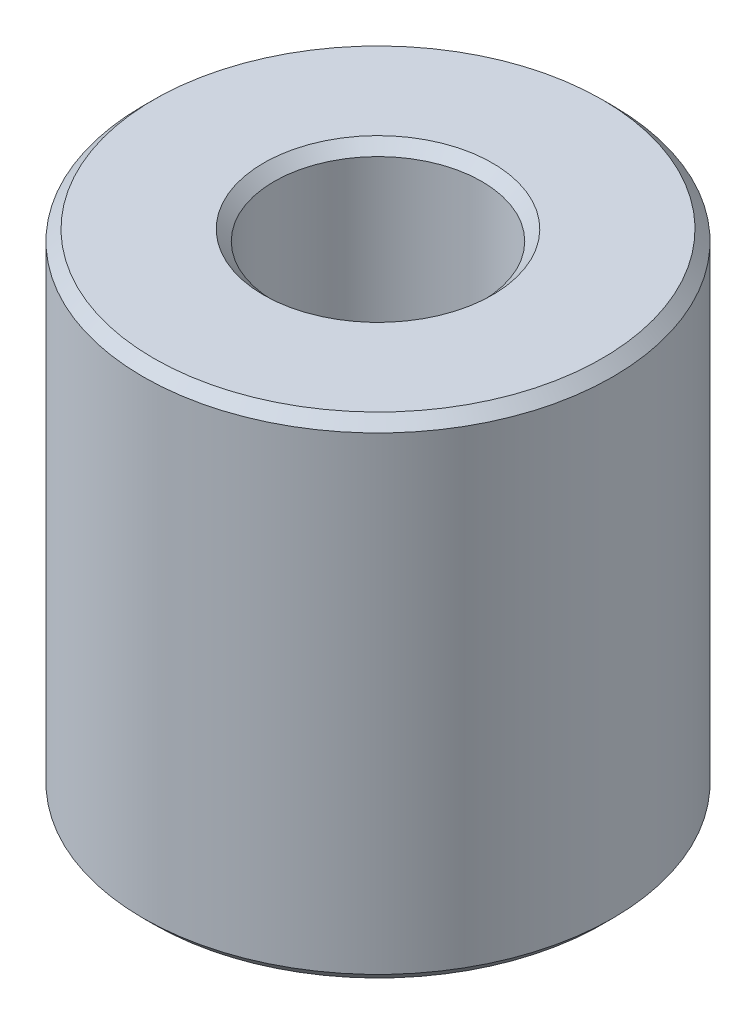
from build123d import *

# Parameters (mm, degrees)
SKETCH1_R           = 40
BOSS_EXTRUDE1_DEPTH = 83.49977816
SKETCH2_R           = 17.679791963
CUT_EXTRUDE1_DEPTH  = 101.857389183
CHAMFER1_SIZE       = 1.810676062


with BuildPart() as part:
    # Sketch1 → Boss-Extrude1 (new body)
    with BuildSketch(Plane(origin=(0, 0, 0), x_dir=(1, 0, 0), z_dir=(0, 1, 0))):
        Circle(SKETCH1_R)
    extrude(amount=BOSS_EXTRUDE1_DEPTH)

    # Sketch2 → Cut-Extrude1 (cut, through all)
    with BuildSketch(Plane(origin=(0, 0, 0), x_dir=(1, 0, 0), z_dir=(0, 1, 0))):
        Circle(SKETCH2_R)
    extrude(amount=CUT_EXTRUDE1_DEPTH, mode=Mode.SUBTRACT)

    # Chamfer1
    chamfer1_edges = [part.edges().sort_by_distance(p)[0] for p in [
        (-17.679791963, 83.49977816, 0),
        (-17.679791963, 0, 0),
        (-40, 0, 0),
        (-40, 83.49977816, 0),
    ]]
    chamfer(chamfer1_edges, length=CHAMFER1_SIZE)


solid = part.part
